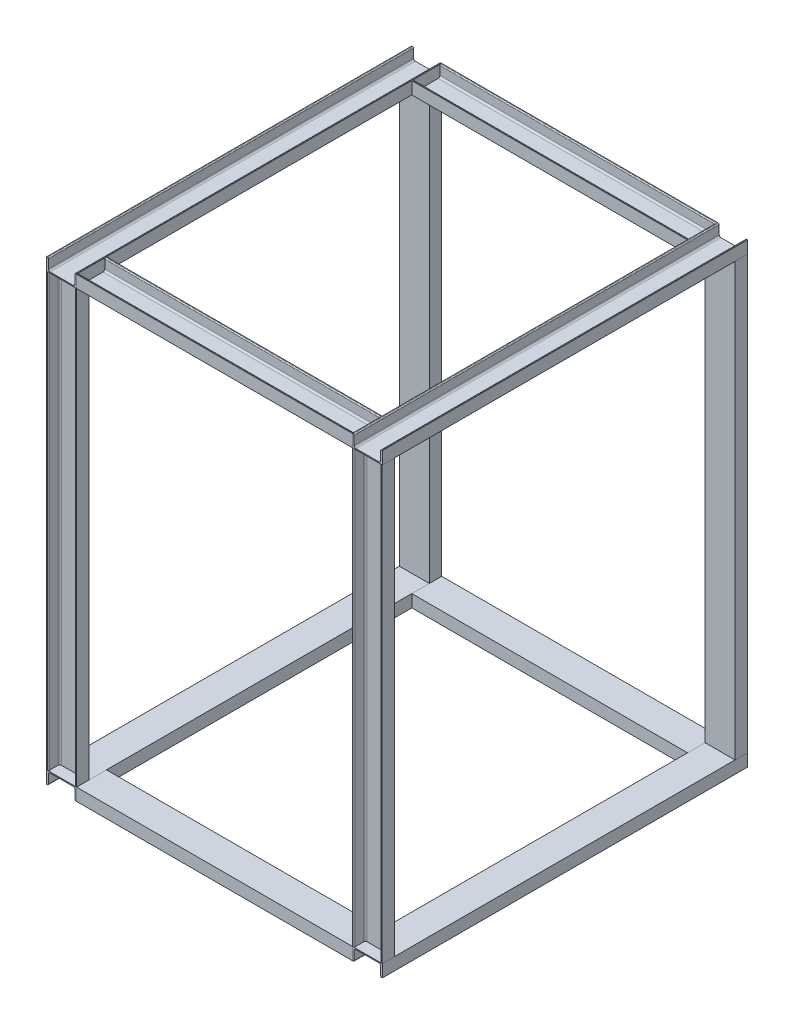
from build123d import *

# Parameters (mm, degrees)
MEMBER_START     = -1708
MEMBER_2_DEPTH   = 1708
MEMBER_2_2_DEPTH = 1708
MEMBER_2_3_DEPTH = 1708
MEMBER_2_4_DEPTH = 1708
MEMBER_3_DEPTH   = 1430
MEMBER_3_2_DEPTH = 1430
MEMBER_5_DEPTH   = 1430
MEMBER_5_2_DEPTH = 1430
MEMBER_6_DEPTH   = 2020
MEMBER_6_2_DEPTH = 2020
MEMBER_7_DEPTH   = 2020
MEMBER_7_2_DEPTH = 2020


with BuildPart() as part:
    # Member 2: read off the stored shape, not the designer's step
    # Member 2 outline → Member 2 (new body)
    with BuildSketch(Plane.XY.offset(MEMBER_START)):
        with BuildLine():
            Line((1360, 2078.2), (1360, 2020))
            Line((1360, 2020), (1500, 2020))
            Line((1500, 2020), (1500, 2078.2))
            Line((1500, 2078.2), (1496.4, 2078.2))
            ThreePointArc((1496.4, 2078.2), (1493.218019485, 2076.881980515), (1491.9, 2073.7))
            Line((1491.9, 2073.7), (1491.9, 2032.9))
            ThreePointArc((1491.9, 2032.9), (1489.556854249, 2027.243145751), (1483.9, 2024.9))
            Line((1483.9, 2024.9), (1376.1, 2024.9))
            ThreePointArc((1376.1, 2024.9), (1370.443145751, 2027.243145751), (1368.1, 2032.9))
            Line((1368.1, 2032.9), (1368.1, 2073.7))
            ThreePointArc((1368.1, 2073.7), (1366.781980515, 2076.881980515), (1363.6, 2078.2))
            Line((1363.6, 2078.2), (1360, 2078.2))
        make_face()
    extrude(amount=MEMBER_2_DEPTH)


with BuildPart() as body_2:
    # Member 2 2 outline → Member 2 2 (new body)
    with BuildSketch(Plane.XY.offset(MEMBER_START)):
        with BuildLine():
            Line((-70, 2078.2), (-70, 2020))
            Line((-70, 2020), (70, 2020))
            Line((70, 2020), (70, 2078.2))
            Line((70, 2078.2), (66.4, 2078.2))
            ThreePointArc((66.4, 2078.2), (63.218019485, 2076.881980515), (61.9, 2073.7))
            Line((61.9, 2073.7), (61.9, 2032.9))
            ThreePointArc((61.9, 2032.9), (59.556854249, 2027.243145751), (53.9, 2024.9))
            Line((53.9, 2024.9), (-53.9, 2024.9))
            ThreePointArc((-53.9, 2024.9), (-59.556854249, 2027.243145751), (-61.9, 2032.9))
            Line((-61.9, 2032.9), (-61.9, 2073.7))
            ThreePointArc((-61.9, 2073.7), (-63.218019485, 2076.881980515), (-66.4, 2078.2))
            Line((-66.4, 2078.2), (-70, 2078.2))
        make_face()
    extrude(amount=MEMBER_2_2_DEPTH)


with BuildPart() as body_3:
    # Member 2 3 outline → Member 2 3 (new body)
    with BuildSketch(Plane.XY.offset(MEMBER_START)):
        with BuildLine():
            Line((70, -58.2), (70, 0))
            Line((70, 0), (-70, 0))
            Line((-70, 0), (-70, -58.2))
            Line((-70, -58.2), (-66.4, -58.2))
            ThreePointArc((-66.4, -58.2), (-63.218019485, -56.881980515), (-61.9, -53.7))
            Line((-61.9, -53.7), (-61.9, -12.9))
            ThreePointArc((-61.9, -12.9), (-59.556854249, -7.243145751), (-53.9, -4.9))
            Line((-53.9, -4.9), (53.9, -4.9))
            ThreePointArc((53.9, -4.9), (59.556854249, -7.243145751), (61.9, -12.9))
            Line((61.9, -12.9), (61.9, -53.7))
            ThreePointArc((61.9, -53.7), (63.218019485, -56.881980515), (66.4, -58.2))
            Line((66.4, -58.2), (70, -58.2))
        make_face()
    extrude(amount=MEMBER_2_3_DEPTH)


with BuildPart() as body_4:
    # Member 2 4 outline → Member 2 4 (new body)
    with BuildSketch(Plane.XY.offset(MEMBER_START)):
        with BuildLine():
            Line((1500, -58.2), (1500, 0))
            Line((1500, 0), (1360, 0))
            Line((1360, 0), (1360, -58.2))
            Line((1360, -58.2), (1363.6, -58.2))
            ThreePointArc((1363.6, -58.2), (1366.781980515, -56.881980515), (1368.1, -53.7))
            Line((1368.1, -53.7), (1368.1, -12.9))
            ThreePointArc((1368.1, -12.9), (1370.443145751, -7.243145751), (1376.1, -4.9))
            Line((1376.1, -4.9), (1483.9, -4.9))
            ThreePointArc((1483.9, -4.9), (1489.556854249, -7.243145751), (1491.9, -12.9))
            Line((1491.9, -12.9), (1491.9, -53.7))
            ThreePointArc((1491.9, -53.7), (1493.218019485, -56.881980515), (1496.4, -58.2))
            Line((1496.4, -58.2), (1500, -58.2))
        make_face()
    extrude(amount=MEMBER_2_4_DEPTH)


with BuildPart() as body_5:
    # Эскиз11 → Member 3 (new body)
    with BuildSketch(Plane(origin=(1430, 2020, 0), x_dir=(0, 1, 0), z_dir=(-1, 0, 0))):
        with BuildLine():
            Line((0, -70), (0, 70))
            Line((0, 70), (57.8, 70))
            Line((57.8, 70), (57.8, 66.4))
            ThreePointArc((57.8, 66.4), (56.481980515, 63.218019485), (53.3, 61.9))
            Line((53.3, 61.9), (12.9, 61.9))
            ThreePointArc((12.9, 61.9), (7.243145751, 59.556854249), (4.9, 53.9))
            Line((4.9, 53.9), (4.9, -53.9))
            ThreePointArc((4.9, -53.9), (7.243145751, -59.556854249), (12.9, -61.9))
            Line((12.9, -61.9), (53.3, -61.9))
            ThreePointArc((53.3, -61.9), (56.481980515, -63.218019485), (57.8, -66.4))
            Line((57.8, -66.4), (57.8, -70))
            Line((57.8, -70), (0, -70))
        make_face()
    extrude(amount=MEMBER_3_DEPTH)


with BuildPart() as body_6:
    # Эскиз11 on segment 2 (carried to segment 2) → Member 3 2 (new body)
    with BuildSketch(Plane(origin=(1430, 2020, -1708), x_dir=(0, 1, 0), z_dir=(-1, 0, 0))):
        with BuildLine():
            Line((0, -70), (0, 70))
            Line((0, 70), (57.8, 70))
            Line((57.8, 70), (57.8, 66.4))
            ThreePointArc((57.8, 66.4), (56.481980515, 63.218019485), (53.3, 61.9))
            Line((53.3, 61.9), (12.9, 61.9))
            ThreePointArc((12.9, 61.9), (7.243145751, 59.556854249), (4.9, 53.9))
            Line((4.9, 53.9), (4.9, -53.9))
            ThreePointArc((4.9, -53.9), (7.243145751, -59.556854249), (12.9, -61.9))
            Line((12.9, -61.9), (53.3, -61.9))
            ThreePointArc((53.3, -61.9), (56.481980515, -63.218019485), (57.8, -66.4))
            Line((57.8, -66.4), (57.8, -70))
            Line((57.8, -70), (0, -70))
        make_face()
    extrude(amount=MEMBER_3_2_DEPTH)


with BuildPart() as body_5_1:
    # Move Body 1: moved
    add(body_5.part.moved(Location((0, 0, -70))))

    # Weld Trim 6 35
    split(bisect_by=Plane.YZ.offset(70), keep=Keep.TOP)

    # Weld Trim 6 70
    split(bisect_by=Plane(origin=(1360, 0, 0), x_dir=(0, -1, 0), z_dir=(-1, 0, 0)), keep=Keep.TOP)


with BuildPart() as body_6_1:
    # Move Body 2: moved
    add(body_6.part.moved(Location((0, 0, 70))))

    # Weld Trim 7 7
    split(bisect_by=Plane(origin=(70, 2049.1, -854), x_dir=(0, 1, 0), z_dir=(1, 0, 0)), keep=Keep.TOP)

    # Weld Trim 7 42
    split(bisect_by=Plane(origin=(1360, 2049.1, -854), x_dir=(0, -1, 0), z_dir=(-1, 0, 0)), keep=Keep.TOP)


with BuildPart() as body_7:
    # Member 5: read off the stored shape, not the designer's step
    # Member 5 outline → Member 5 (new body)
    with BuildSketch(Plane.YZ):
        with BuildLine():
            Line((-58, -1708), (0, -1708))
            Line((0, -1708), (0, -1568))
            Line((0, -1568), (-58, -1568))
            Line((-58, -1568), (-58, -1571.6))
            ThreePointArc((-58, -1571.6), (-56.681980515, -1574.781980515), (-53.5, -1576.1))
            Line((-53.5, -1576.1), (-12.9, -1576.1))
            ThreePointArc((-12.9, -1576.1), (-7.243145751, -1578.443145751), (-4.9, -1584.1))
            Line((-4.9, -1584.1), (-4.9, -1691.9))
            ThreePointArc((-4.9, -1691.9), (-7.243145751, -1697.556854249), (-12.9, -1699.9))
            Line((-12.9, -1699.9), (-53.5, -1699.9))
            ThreePointArc((-53.5, -1699.9), (-56.681980515, -1701.218019485), (-58, -1704.4))
            Line((-58, -1704.4), (-58, -1708))
        make_face()
    extrude(amount=MEMBER_5_DEPTH)

    # Weld Trim 4 5
    split(bisect_by=Plane(origin=(70, -29.1, -854), x_dir=(0, 1, 0), z_dir=(1, 0, 0)), keep=Keep.TOP)

    # Weld Trim 5 7
    split(bisect_by=Plane(origin=(1360, -29.1, -854), x_dir=(0, -1, 0), z_dir=(-1, 0, 0)), keep=Keep.TOP)


with BuildPart() as body_8:
    # Member 5 2 outline → Member 5 2 (new body)
    with BuildSketch(Plane.YZ):
        with BuildLine():
            Line((0, 0), (-58, 0))
            Line((-58, 0), (-58, -3.6))
            ThreePointArc((-58, -3.6), (-56.681980515, -6.781980515), (-53.5, -8.1))
            Line((-53.5, -8.1), (-12.9, -8.1))
            ThreePointArc((-12.9, -8.1), (-7.243145751, -10.443145751), (-4.9, -16.1))
            Line((-4.9, -16.1), (-4.9, -123.9))
            ThreePointArc((-4.9, -123.9), (-7.243145751, -129.556854249), (-12.9, -131.9))
            Line((-12.9, -131.9), (-53.5, -131.9))
            ThreePointArc((-53.5, -131.9), (-56.681980515, -133.218019485), (-58, -136.4))
            Line((-58, -136.4), (-58, -140))
            Line((-58, -140), (0, -140))
            Line((0, -140), (0, 0))
        make_face()
    extrude(amount=MEMBER_5_2_DEPTH)

    # Weld Trim 2 33
    split(bisect_by=Plane.YZ.offset(70), keep=Keep.TOP)

    # Weld Trim 3 33
    split(bisect_by=Plane(origin=(1360, 0, 0), x_dir=(0, -1, 0), z_dir=(-1, 0, 0)), keep=Keep.TOP)


with BuildPart() as body_9:
    # Эскиз16 → Member 6 (new body)
    with BuildSketch(Plane(origin=(0, 2020, 0), x_dir=(0, 0, 1), z_dir=(0, -1, 0))):
        with BuildLine():
            Line((0, -70), (0, 70))
            Line((0, 70), (58.2, 70))
            Line((58.2, 70), (58.2, 66.4))
            ThreePointArc((58.2, 66.4), (56.881980515, 63.218019485), (53.7, 61.9))
            Line((53.7, 61.9), (12.9, 61.9))
            ThreePointArc((12.9, 61.9), (7.243145751, 59.556854249), (4.9, 53.9))
            Line((4.9, 53.9), (4.9, -53.9))
            ThreePointArc((4.9, -53.9), (7.243145751, -59.556854249), (12.9, -61.9))
            Line((12.9, -61.9), (53.7, -61.9))
            ThreePointArc((53.7, -61.9), (56.881980515, -63.218019485), (58.2, -66.4))
            Line((58.2, -66.4), (58.2, -70))
            Line((58.2, -70), (0, -70))
        make_face()
    extrude(amount=MEMBER_6_DEPTH)


with BuildPart() as body_10:
    # Эскиз16 on segment 2 (carried to segment 2) → Member 6 2 (new body)
    with BuildSketch(Plane(origin=(1430, 2020, 0), x_dir=(0, 0, 1), z_dir=(0, -1, 0))):
        with BuildLine():
            Line((0, -70), (0, 70))
            Line((0, 70), (58.2, 70))
            Line((58.2, 70), (58.2, 66.4))
            ThreePointArc((58.2, 66.4), (56.881980515, 63.218019485), (53.7, 61.9))
            Line((53.7, 61.9), (12.9, 61.9))
            ThreePointArc((12.9, 61.9), (7.243145751, 59.556854249), (4.9, 53.9))
            Line((4.9, 53.9), (4.9, -53.9))
            ThreePointArc((4.9, -53.9), (7.243145751, -59.556854249), (12.9, -61.9))
            Line((12.9, -61.9), (53.7, -61.9))
            ThreePointArc((53.7, -61.9), (56.881980515, -63.218019485), (58.2, -66.4))
            Line((58.2, -66.4), (58.2, -70))
            Line((58.2, -70), (0, -70))
        make_face()
    extrude(amount=MEMBER_6_2_DEPTH)


with BuildPart() as body_9_1:
    # Move Body 3: moved
    add(body_9.part.moved(Location((0, 0, -58))))


with BuildPart() as body_10_1:
    # Move Body 3: moved
    add(body_10.part.moved(Location((0, 0, -58))))


with BuildPart() as body_11:
    # Эскиз17 → Member 7 (new body)
    with BuildSketch(Plane(origin=(1430, 0, -1708), x_dir=(0, 0, -1), z_dir=(0, 1, 0))):
        with BuildLine():
            Line((0, -70), (0, 70))
            Line((0, 70), (57.8, 70))
            Line((57.8, 70), (57.8, 66.4))
            ThreePointArc((57.8, 66.4), (56.481980515, 63.218019485), (53.3, 61.9))
            Line((53.3, 61.9), (12.9, 61.9))
            ThreePointArc((12.9, 61.9), (7.243145751, 59.556854249), (4.9, 53.9))
            Line((4.9, 53.9), (4.9, -53.9))
            ThreePointArc((4.9, -53.9), (7.243145751, -59.556854249), (12.9, -61.9))
            Line((12.9, -61.9), (53.3, -61.9))
            ThreePointArc((53.3, -61.9), (56.481980515, -63.218019485), (57.8, -66.4))
            Line((57.8, -66.4), (57.8, -70))
            Line((57.8, -70), (0, -70))
        make_face()
    extrude(amount=MEMBER_7_DEPTH)


with BuildPart() as body_12:
    # Эскиз17 on segment 2 (carried to segment 2) → Member 7 2 (new body)
    with BuildSketch(Plane(origin=(0, 0, -1708), x_dir=(0, 0, -1), z_dir=(0, 1, 0))):
        with BuildLine():
            Line((0, -70), (0, 70))
            Line((0, 70), (57.8, 70))
            Line((57.8, 70), (57.8, 66.4))
            ThreePointArc((57.8, 66.4), (56.481980515, 63.218019485), (53.3, 61.9))
            Line((53.3, 61.9), (12.9, 61.9))
            ThreePointArc((12.9, 61.9), (7.243145751, 59.556854249), (4.9, 53.9))
            Line((4.9, 53.9), (4.9, -53.9))
            ThreePointArc((4.9, -53.9), (7.243145751, -59.556854249), (12.9, -61.9))
            Line((12.9, -61.9), (53.3, -61.9))
            ThreePointArc((53.3, -61.9), (56.481980515, -63.218019485), (57.8, -66.4))
            Line((57.8, -66.4), (57.8, -70))
            Line((57.8, -70), (0, -70))
        make_face()
    extrude(amount=MEMBER_7_2_DEPTH)


with BuildPart() as body_11_1:
    # Move Body 4: moved
    add(body_11.part.moved(Location((0, 0, 58))))


with BuildPart() as body_12_1:
    # Move Body 4: moved
    add(body_12.part.moved(Location((0, 0, 58))))


solid = Compound([part.part, body_2.part, body_3.part, body_4.part, body_5_1.part, body_6_1.part, body_7.part, body_8.part, body_9_1.part, body_10_1.part, body_11_1.part, body_12_1.part])
